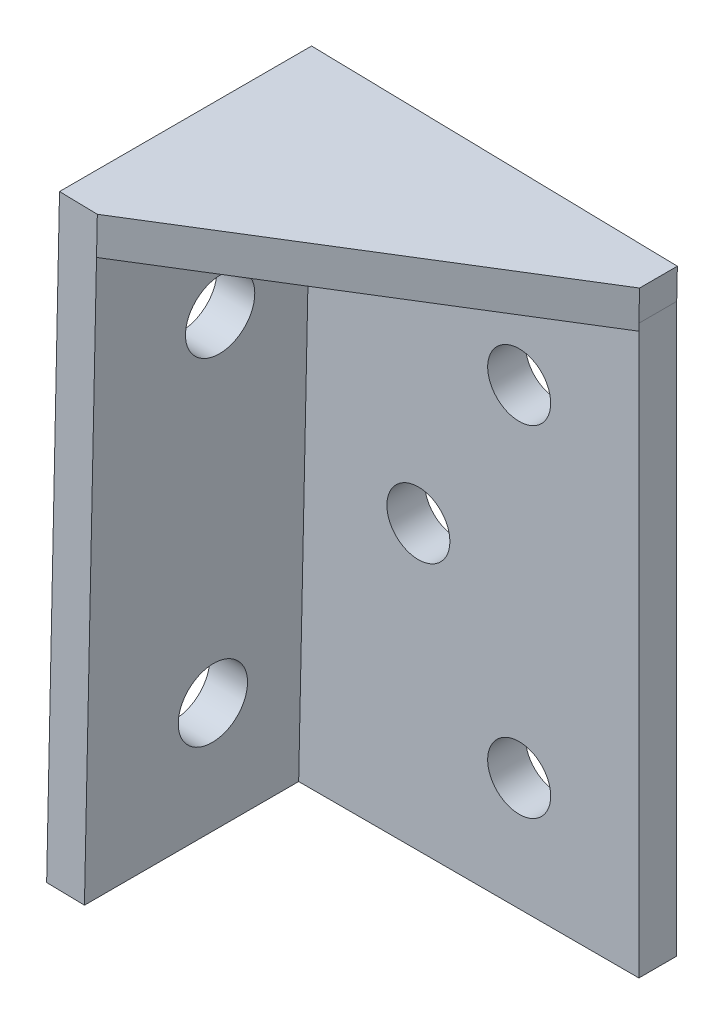
from build123d import *

# Parameters (mm, degrees)
SKETCH1_R           = 2.5
BOSS_EXTRUDE1_DEPTH = 3
SKETCH2_W           = 20
SKETCH2_H           = 45.01020326
SKETCH2_R           = 2.75
BOSS_EXTRUDE2_DEPTH = 3
BOSS_EXTRUDE3_DEPTH = 3


with BuildPart() as part:
    # Sketch1 → Boss-Extrude1 (new body)
    with BuildSketch(Plane.XY):
        Polygon((0, 0), (0.958330597, 45), (27, 45), (27, 0), align=None)
        with Locations((17.5, 36)):
            Circle(SKETCH1_R, mode=Mode.SUBTRACT)
        with Locations((17.5, 9)):
            Circle(SKETCH1_R, mode=Mode.SUBTRACT)
        with Locations((9.5, 22.5)):
            Circle(SKETCH1_R, mode=Mode.SUBTRACT)
    extrude(amount=BOSS_EXTRUDE1_DEPTH)

    # Sketch2 → Boss-Extrude2 (add)
    with BuildSketch(Plane(origin=(0, 0, 0), x_dir=(0, 0, 1), z_dir=(-0.9997733122812661, 0.021291407894877462, 0))):
        with Locations((10, 22.50510163)):
            Rectangle(SKETCH2_W, SKETCH2_H)
        with Locations((10, 36.01020326)):
            Circle(SKETCH2_R, mode=Mode.SUBTRACT)
        with Locations((10, 9)):
            Circle(SKETCH2_R, mode=Mode.SUBTRACT)
    extrude(amount=BOSS_EXTRUDE2_DEPTH)

    # Sketch3 → Boss-Extrude3 (add)
    with BuildSketch(Plane(origin=(0.958330597, 45, 0), x_dir=(0.9997733122812661, -0.02129140789487747, 0), z_dir=(0.02129140789487747, 0.9997733122812661, 0))):
        Polygon((0, -20), (26.035766076, -3), (26.035766076, 0), (-3, 0), (-3, -20), align=None)
    extrude(amount=BOSS_EXTRUDE3_DEPTH)


solid = part.part
